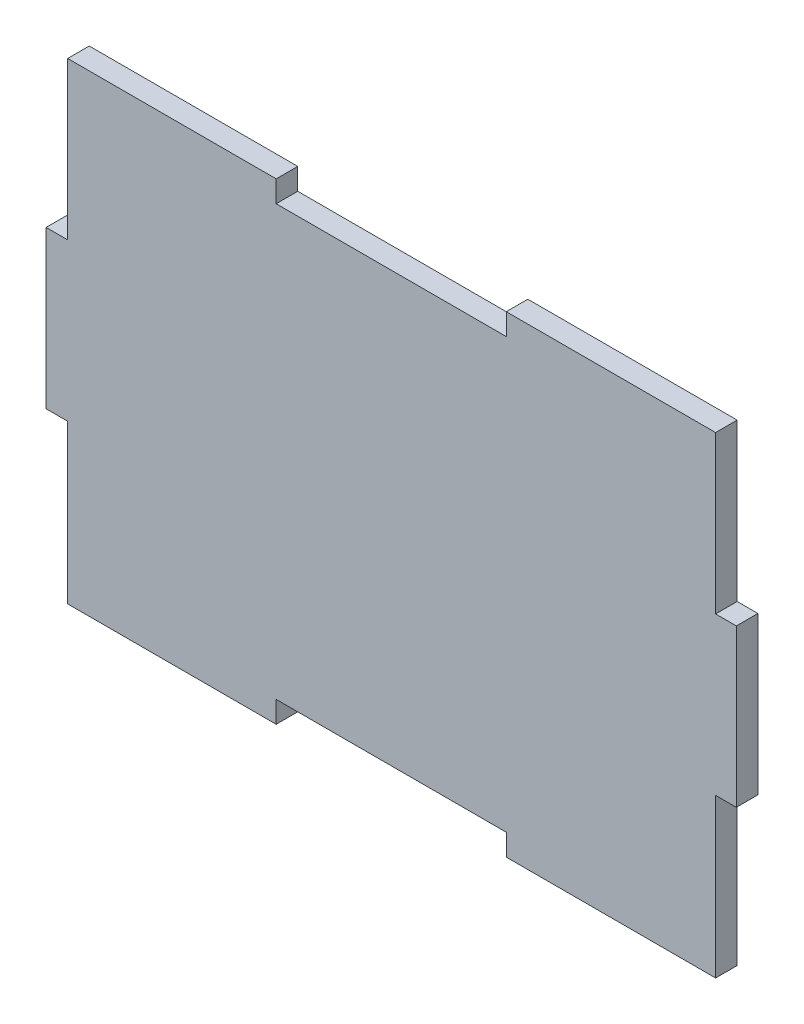
from build123d import *

# Parameters (mm, degrees)
SKETCH1_W           = 81.28
SKETCH1_H           = 55.626
BOSS_EXTRUDE1_DEPTH = 2.54
SKETCH2_W           = 2.54
SKETCH2_H           = 18.499605323
SKETCH2_H_2         = 18.818048641
CUT_EXTRUDE1_DEPTH  = 50.311501387
CAVITY9_START       = -27.813
CAVITY9_OUTLINE_W   = 27.093333334
CAVITY9_OUTLINE_H   = 2.54
CAVITY9_DEPTH       = 2.54
CAVITY9_START_2     = 25.273
CAVITY9_2_OUTLINE_W = 27.093333334
CAVITY9_2_OUTLINE_H = 2.54
CAVITY9_2_DEPTH     = 2.54


# Read off the part's stored shape, not the designer's step: Cavity9
with BuildPart() as part:
    # Sketch1 → Boss-Extrude1 (new body)
    with BuildSketch(Plane.XY):
        Rectangle(SKETCH1_W, SKETCH1_H)
    extrude(amount=BOSS_EXTRUDE1_DEPTH)

    # Sketch2 → Cut-Extrude1 (cut, through all)
    with BuildSketch(Plane.XY.offset(2.54)):
        with Locations((-39.37, 18.563197339)):
            Rectangle(SKETCH2_W, SKETCH2_H)
        with Locations((-39.37, -18.595234966)):
            Rectangle(SKETCH2_W, SKETCH2_H_2)
        with Locations((39.469570783, -18.595234966)):
            Rectangle(SKETCH2_W, SKETCH2_H_2)
        with Locations((39.469570783, 18.563197339)):
            Rectangle(SKETCH2_W, SKETCH2_H)
    extrude(amount=-CUT_EXTRUDE1_DEPTH, mode=Mode.SUBTRACT)

    # Cavity9 outline → Cavity9 (cut)
    with BuildSketch(Plane(origin=(0, 0, 0), x_dir=(1, 0, 0), z_dir=(0, 1, 0)).offset(CAVITY9_START)):
        with Locations((0, -1.27)):
            Rectangle(CAVITY9_OUTLINE_W, CAVITY9_OUTLINE_H)
    extrude(amount=CAVITY9_DEPTH, mode=Mode.SUBTRACT)

    # Cavity9 2 outline → Cavity9 2 (cut)
    with BuildSketch(Plane(origin=(0, 0, 0), x_dir=(1, 0, 0), z_dir=(0, 1, 0)).offset(CAVITY9_START_2)):
        with Locations((0, -1.27)):
            Rectangle(CAVITY9_2_OUTLINE_W, CAVITY9_2_OUTLINE_H)
    extrude(amount=CAVITY9_2_DEPTH, mode=Mode.SUBTRACT)


solid = part.part
